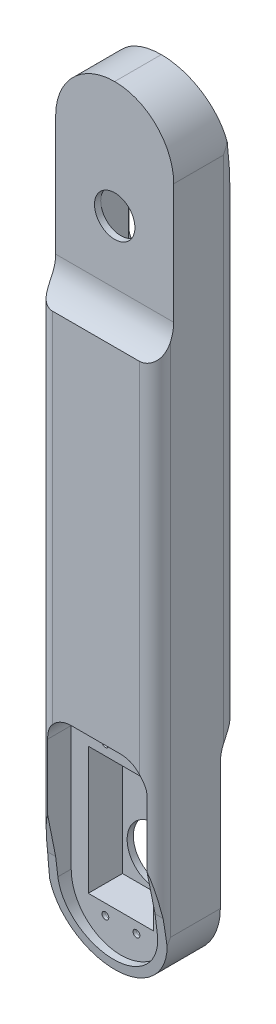
from build123d import *

# Parameters (mm, degrees)
SKETCH1_W               = 38
SKETCH1_H               = 227.5
SKETCH1_W_2             = 21
SKETCH1_H_2             = 41
BOSS_EXTRUDE1_DEPTH     = 11
SKETCH3_R               = 1.3
CUT_EXTRUDE1_DEPTH      = 8
FILLET3_R               = 19
BOSS_EXTRUDE2_DEPTH     = 8
CUT_EXTRUDE2_DEPTH      = 117.880547997
CUT_EXTRUDE2_DEPTH_BACK = 117.880547997
SKETCH7_W               = 32
SKETCH7_H               = 157.5
BOSS_EXTRUDE4_DEPTH     = 8
SKETCH8_W               = 38
SKETCH8_H               = 157.5
BOSS_EXTRUDE5_DEPTH     = 8
BOSS_EXTRUDE10_START    = 2
SKETCH27_R              = 9
BOSS_EXTRUDE10_DEPTH    = 2
SKETCH28_W              = 38
SKETCH28_H              = 27
BOSS_EXTRUDE11_DEPTH    = 20
FILLET4_R               = 19
CUT_EXTRUDE14_DEPTH     = 8
SKETCH30_W              = 13
SKETCH30_H              = 24
CUT_EXTRUDE15_DEPTH     = 11
CUT_EXTRUDE16_REACH     = 138.422
SKETCH31_R              = 6.5
CUT_EXTRUDE17_START     = 65.75
CUT_EXTRUDE17_OUTLINE_W = 38
CUT_EXTRUDE17_OUTLINE_H = 6
CUT_EXTRUDE17_DEPTH     = 68
FILLET5_R               = 12
CUT_EXTRUDE18_DEPTH     = 141.335535414
FILLET7_R               = 5
SKETCH34_R              = 1.5
CUT_EXTRUDE19_DEPTH     = 8
SKETCH35_R              = 1.1
CUT_EXTRUDE20_DEPTH     = 8
FILLET8_R               = 8
SKETCH36_W              = 21
SKETCH36_H              = 40
CUT_EXTRUDE21_DEPTH     = 2


# Read off the part's stored shape, not the designer's step: Cut-Extrude17
# Some blends are built 0.0001 mm under size
with BuildPart() as part:
    # Sketch1 → Boss-Extrude1 (new body)
    with BuildSketch(Plane.XY):
        Rectangle(SKETCH1_W, SKETCH1_H)
        with Locations((0, -78.25)):
            Rectangle(SKETCH1_W_2, SKETCH1_H_2, mode=Mode.SUBTRACT)
    extrude(amount=BOSS_EXTRUDE1_DEPTH)

    # Sketch3 → Cut-Extrude1 (cut)
    with BuildSketch(Plane.XY.offset(10)):
        with Locations((-5, -54.25)):
            Circle(SKETCH3_R)
        with Locations((5, -54.25)):
            Circle(SKETCH3_R)
        with Locations((5, -102.25)):
            Circle(SKETCH3_R)
        with Locations((-5, -102.25)):
            Circle(SKETCH3_R)
    extrude(amount=-CUT_EXTRUDE1_DEPTH, mode=Mode.SUBTRACT)

    # Fillet3
    fillet3_edges = [part.edges().sort_by_distance(p)[0] for p in [
        (19, -113.75, 5.5),
        (-19, -113.75, 5.5),
    ]]
    fillet(fillet3_edges, radius=FILLET3_R - 0.0001)  # a hair under: the kernel refuses the full size

    # Sketch4 → Boss-Extrude2 (add)
    with BuildSketch(Plane.XY.offset(11)):
        with BuildLine():
            Line((19, -94.75), (19, 113.75))
            Line((19, 113.75), (-19, 113.75))
            Line((-19, 113.75), (-19, -94.75))
            ThreePointArc((-19, -94.75), (-13.435028843, -108.185028843), (0, -113.75))
            ThreePointArc((0, -113.75), (13.435028843, -108.185028843), (19, -94.75))
        make_face()
        with BuildLine():
            Line((16, -94.75), (16, 110.75))
            Line((16, 110.75), (-16, 110.75))
            Line((-16, 110.75), (-16, -94.75))
            ThreePointArc((-16, -94.75), (-11.313708499, -106.063708499), (0, -110.75))
            ThreePointArc((0, -110.75), (11.313708499, -106.063708499), (16, -94.75))
        make_face(mode=Mode.SUBTRACT)
    extrude(amount=BOSS_EXTRUDE2_DEPTH)

    # Sketch6 → Cut-Extrude2 (cut, two sides: drawn at the far end of the back side and taken through both)
    with BuildSketch(Plane(origin=(0, 0, 0), x_dir=(0, 0, -1), z_dir=(1, 0, 0)).offset(-CUT_EXTRUDE2_DEPTH_BACK)):
        Polygon((-13, -113.75), (-16, -88.75), (-19, -73.75), (-19, -113.75), align=None)
    extrude(amount=CUT_EXTRUDE2_DEPTH + CUT_EXTRUDE2_DEPTH_BACK, mode=Mode.SUBTRACT)

    # Sketch7 → Boss-Extrude4 (add)
    with BuildSketch(Plane.XY.offset(11)):
        with Locations((0, 32)):
            Rectangle(SKETCH7_W, SKETCH7_H)
    extrude(amount=BOSS_EXTRUDE4_DEPTH)

    # Sketch8 → Boss-Extrude5 (add)
    with BuildSketch(Plane(origin=(0, 0, 0), x_dir=(-1, 0, 0), z_dir=(0, 0, -1))):
        with Locations((0, 35)):
            Rectangle(SKETCH8_W, SKETCH8_H)
    extrude(amount=BOSS_EXTRUDE5_DEPTH)

    # Sketch27 → Boss-Extrude10 (add)
    with BuildSketch(Plane(origin=(0, 0, 0), x_dir=(-1, 0, 0), z_dir=(0, 0, -1)).offset(BOSS_EXTRUDE10_START)):
        with BuildLine():
            Line((19, -94.75), (19, -43.75))
            Line((19, -43.75), (-19, -43.75))
            Line((-19, -43.75), (-19, -94.75))
            ThreePointArc((-19, -94.75), (-13.435028843, -108.185028843), (0, -113.75))
            ThreePointArc((0, -113.75), (13.435028843, -108.185028843), (19, -94.75))
        make_face()
        with Locations((0, -88.5)):
            Circle(SKETCH27_R, mode=Mode.SUBTRACT)
    extrude(amount=-BOSS_EXTRUDE10_DEPTH)

    # Sketch28 → Boss-Extrude11 (add)
    with BuildSketch(Plane(origin=(0, 113.75, 0), x_dir=(1, 0, 0), z_dir=(0, 1, 0))):
        with Locations((0, -5.5)):
            Rectangle(SKETCH28_W, SKETCH28_H)
    extrude(amount=BOSS_EXTRUDE11_DEPTH)

    # Fillet4
    fillet4_edges = [part.edges().sort_by_distance(p)[0] for p in [
        (-19, 133.75, 5.5),
        (19, 133.75, 5.5),
    ]]
    fillet(fillet4_edges, radius=FILLET4_R - 0.0001)  # a hair under: the kernel refuses the full size

    # Sketch29 → Cut-Extrude14 (cut)
    with BuildSketch(Plane(origin=(0, 0, -8), x_dir=(-1, 0, 0), z_dir=(0, 0, -1))):
        with BuildLine():
            Line((16, 66.75), (16, 114.75))
            ThreePointArc((16, 114.75), (11.313708499, 126.063708499), (0, 130.75))
            ThreePointArc((0, 130.75), (-11.313708499, 126.063708499), (-16, 114.75))
            Line((-16, 114.75), (-16, 66.75))
            Line((-16, 66.75), (16, 66.75))
        make_face()
    extrude(amount=-CUT_EXTRUDE14_DEPTH, mode=Mode.SUBTRACT)

    # Sketch30 → Cut-Extrude15 (cut)
    with BuildSketch(Plane(origin=(0, 0, 0), x_dir=(-1, 0, 0), z_dir=(0, 0, -1))):
        with Locations((0, 90.75)):
            Rectangle(SKETCH30_W, SKETCH30_H)
    extrude(amount=-CUT_EXTRUDE15_DEPTH, mode=Mode.SUBTRACT)

    # Sketch31 → Cut-Extrude16 (cut, up to next)
    with BuildSketch(Plane(origin=(0, 0, 11), x_dir=(-1, 0, 0), z_dir=(0, 0, -1)), mode=Mode.PRIVATE) as cut_extrude16_sk1:
        with Locations(Location((0, 96.25, 0), (0, 0, 180))):
            Circle(SKETCH31_R)
    cut_extrude16_tool1 = extrude(cut_extrude16_sk1.sketch, amount=-CUT_EXTRUDE16_REACH, mode=Mode.PRIVATE) & part.part
    add(cut_extrude16_tool1.solids().sort_by_distance((0, 96.25, 11))[0], mode=Mode.SUBTRACT)

    # Cut-Extrude17 outline → Cut-Extrude17 (cut)
    with BuildSketch(Plane(origin=(0, 0, 0), x_dir=(1, 0, 0), z_dir=(0, 1, 0)).offset(CUT_EXTRUDE17_START)):
        with Locations((0, -16)):
            Rectangle(CUT_EXTRUDE17_OUTLINE_W, CUT_EXTRUDE17_OUTLINE_H)
    extrude(amount=CUT_EXTRUDE17_DEPTH, mode=Mode.SUBTRACT)

    # Fillet5
    # the kernel refuses this fillet: 12 mm, written as the material it adds along each edge
    with BuildSketch(Plane(origin=(-19, -43.75, -2), x_dir=(0, 0, -1), z_dir=(1, 0, 0))) as fillet5_piece_1:
        with BuildLine():
            CenterArc((12, -10.392304845), FILLET5_R, 120, 60)
            Line((0, -10.392304845), (-0.24, -10.392304845))
            Line((-0.24, -10.392304845), (-0.24, 0))
            Line((-0.24, 0), (0, 0.24))
            ThreePointArc((0, 0.24), (3, 0.24), (5.88, 0.207846097))
            Line((5.88, 0.207846097), (6, 0))
        make_face()
    extrude(amount=38)
    with BuildSketch(Plane(origin=(19, 65.75, 13), x_dir=(0, 0, 1), z_dir=(-1, 0, 0))) as fillet5_piece_2:
        with BuildLine():
            CenterArc((12, 10.392304845), FILLET5_R, 180, 60)
            Line((0, 10.392304845), (-0.24, 10.392304845))
            Line((-0.24, 10.392304845), (-0.24, 0))
            Line((-0.24, 0), (0, -0.24))
            ThreePointArc((0, -0.24), (3, -0.24), (5.88, -0.207846097))
            Line((5.88, -0.207846097), (6, 0))
        make_face()
    extrude(amount=38)

    # Sketch33 → Cut-Extrude18 (cut, through all)
    with BuildSketch(Plane(origin=(19, 0, 0), x_dir=(0, 0, -1), z_dir=(1, 0, 0))):
        Polygon((2, 133.75), (8, 93.75), (8, 133.75), align=None)
    extrude(amount=-CUT_EXTRUDE18_DEPTH, mode=Mode.SUBTRACT)

    # Fillet7
    # the kernel refuses this fillet: 5 mm, written as the material it takes off along each edge
    with BuildSketch(Plane(origin=(-19, 123.75, -8), x_dir=(0, 0, 1), z_dir=(0, -1, 0)), Plane(origin=(19, -73.75, -8), x_dir=(0, 0, 1), z_dir=(0, 1, 0))) as fillet7_piece_1:
        with BuildLine():
            CenterArc((FILLET7_R, -FILLET7_R), FILLET7_R, 90, 90)
            Line((0, -FILLET7_R), (-FILLET7_R * 0.02, -FILLET7_R))
            Line((-FILLET7_R * 0.02, -FILLET7_R), (-FILLET7_R * 0.02, FILLET7_R * 0.02))
            Line((-FILLET7_R * 0.02, FILLET7_R * 0.02), (FILLET7_R, FILLET7_R * 0.02))
            Line((FILLET7_R, FILLET7_R * 0.02), (FILLET7_R, 0))
        make_face()
    extrude(amount=197.5, mode=Mode.SUBTRACT)
    with BuildSketch(Plane(origin=(-19, -103.75, 19), x_dir=(1, 0, 0), z_dir=(0, 1, 0)), Plane(origin=(19, 95.75, 19), x_dir=(-1, 0, 0), z_dir=(0, -1, 0))) as fillet7_piece_2:
        with BuildLine():
            CenterArc((FILLET7_R, FILLET7_R), FILLET7_R, 180, 90)
            Line((0, FILLET7_R), (-FILLET7_R * 0.02, FILLET7_R))
            Line((-FILLET7_R * 0.02, FILLET7_R), (-FILLET7_R * 0.02, -FILLET7_R * 0.02))
            Line((-FILLET7_R * 0.02, -FILLET7_R * 0.02), (FILLET7_R, -FILLET7_R * 0.02))
            Line((FILLET7_R, -FILLET7_R * 0.02), (FILLET7_R, 0))
        make_face()
    extrude(amount=199.5, mode=Mode.SUBTRACT)

    # Sketch34 → Cut-Extrude19 (cut)
    with BuildSketch(Plane(origin=(0, 0, 0), x_dir=(-1, 0, 0), z_dir=(0, 0, -1))):
        with Locations((0, 105.75)):
            Circle(SKETCH34_R)
        with Locations((0, 75.75)):
            Circle(SKETCH34_R)
    extrude(amount=-CUT_EXTRUDE19_DEPTH, mode=Mode.SUBTRACT)

    # Sketch35 → Cut-Extrude20 (cut)
    with BuildSketch(Plane.XY.offset(11)):
        with Locations((-5, -54.25)):
            Circle(SKETCH35_R)
        with Locations((5, -54.25)):
            Circle(SKETCH35_R)
        with Locations((5, -102.25)):
            Circle(SKETCH35_R)
        with Locations((-5, -102.25)):
            Circle(SKETCH35_R)
    extrude(amount=-CUT_EXTRUDE20_DEPTH, mode=Mode.SUBTRACT)

    # Fillet8
    fillet8_edges = [part.edges().sort_by_distance(p)[0] for p in [
        (-16, -46.75, 14.791287847),
        (16, -46.75, 14.791287847),
        (16, 66.75, -3.791287847),
        (-16, 66.75, -3.791287847),
    ]]
    fillet(fillet8_edges, radius=FILLET8_R)

    # Sketch36 → Cut-Extrude21 (cut)
    with BuildSketch(Plane(origin=(0, 0, 0), x_dir=(-1, 0, 0), z_dir=(0, 0, -1))):
        with Locations((0, 90.75)):
            Rectangle(SKETCH36_W, SKETCH36_H)
    extrude(amount=-CUT_EXTRUDE21_DEPTH, mode=Mode.SUBTRACT)


solid = part.part
